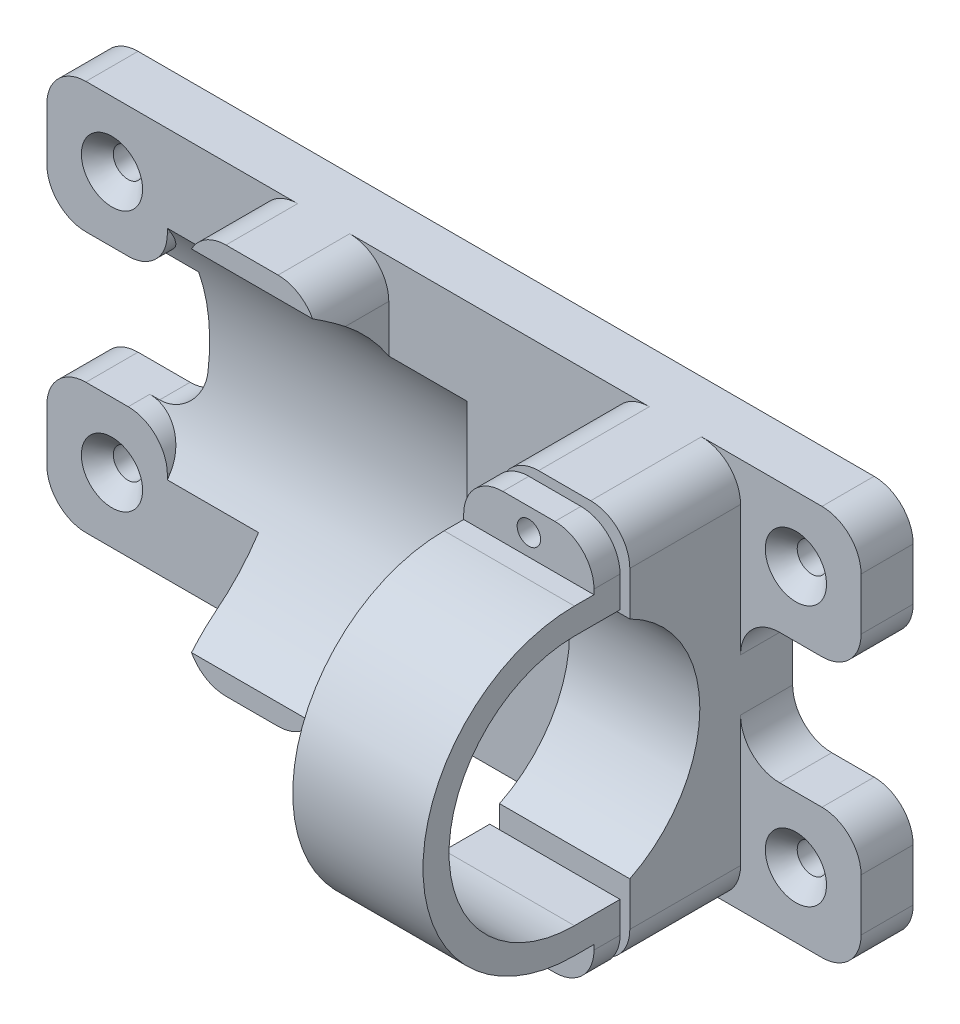
from build123d import *

# Parameters (mm, degrees)
BASE_SKETCH_W               = 85
BASE_SKETCH_H               = 60
BASE_EXTRUDE_DEPTH          = 8
CRADLE_SKETCH_W             = 20
CRADLE_SKETCH_H             = 60
CRADLE_EXTRUDE_DEPTH        = 25
MOUNTING_TAB_SKETCH_W       = 20
MOUNTING_TAB_SKETCH_H       = 20
MOUNTING_TAB_EXTRUDE_DEPTH  = 8
MOUNTING_TAB_FILLET_R       = 6
MOVE_START                  = 19
MOVE_FACE_OUTLINE_W         = 20
MOVE_FACE_OUTLINE_H         = 60
MOVE_FACE_DEPTH             = 6
CLAMP_THREADED_HOLE_D       = 2.5
MOTOR_START                 = 24
MOTOR_CLAMP_EXTRUDE_DEPTH   = 20
SKETCH9_W                   = 1.8
SKETCH9_H                   = 4
BASE_CORNER_FILLETS_R       = 6
BASE_INISDE_CORNER_FILLET_R = 6
CLAMP_CORNER_FILLETS_R      = 6


# Read off the part's stored shape, not the designer's step: Move Face
with BuildPart() as part:
    # Base Sketch → Base Extrude (new body)
    with BuildSketch(Plane.XY):
        Rectangle(BASE_SKETCH_W, BASE_SKETCH_H)
    extrude(amount=BASE_EXTRUDE_DEPTH)

    # Cradle Sketch → Cradle Extrude (add)
    with BuildSketch(Plane.XY):
        with Locations((-20, 0)):
            Rectangle(CRADLE_SKETCH_W, CRADLE_SKETCH_H)
        with Locations((34, 0)):
            Rectangle(CRADLE_SKETCH_W, CRADLE_SKETCH_H)
    extrude(amount=CRADLE_EXTRUDE_DEPTH)


with BuildPart() as body_2:
    # Mounting Tab Sketch → Mounting Tab Extrude (new body)
    with BuildSketch(Plane.XY):
        with Locations((-52.5, -20)):
            Rectangle(MOUNTING_TAB_SKETCH_W, MOUNTING_TAB_SKETCH_H)
    extrude(amount=MOUNTING_TAB_EXTRUDE_DEPTH)

    # Mounting Tab M4 CS Clearance Hole Profile Sketch → Mounting Tab M4 Counter Sink Clearance Hole (revolve, cut)
    with BuildSketch(Plane(origin=(-52.5, -20, 8), x_dir=(0, -1, 0), z_dir=(1, 0, 0))):
        Polygon((0, 0), (0, 8), (2.25, 8), (2.25, 2.45), (4.7, 0), align=None)
    revolve(axis=Axis((-52.5, -20, 14.35), (0, 0, -1)), mode=Mode.SUBTRACT)

    # Mounting Tab Fillet
    mounting_tab_fillet_edges = [body_2.edges().sort_by_distance(p)[0] for p in [
        (-62.5, -30, 4),
        (-62.5, -10, 4),
    ]]
    fillet(mounting_tab_fillet_edges, radius=MOUNTING_TAB_FILLET_R)


with BuildPart() as body_3:
    # Mounting Tab Mirror Lengthwise: mirrored copy
    add(body_2.part.mirror(Plane(origin=(0, 0, 0), x_dir=(0, 0, 1), z_dir=(1, 0, 0))))


with BuildPart() as body_4:
    # Mounting Tab Mirror Width: mirrored copy
    add(body_2.part.mirror(Plane.ZX))


with BuildPart() as body_5:
    # Mounting Tab Mirror Width 2: mirrored copy
    add(body_3.part.mirror(Plane.ZX))


with BuildPart() as part_1:
    add(part.part)

    # Base and Tabs Combine: union body 2, body 3, body 4, body 5
    add(body_2.part)
    add(body_3.part)
    add(body_4.part)
    add(body_5.part)

    # Pump and Motor Revolve Cut Sketch → Pump and Motor Revolve Cut (revolve, cut)
    with BuildSketch(Plane(origin=(0, 0, 0), x_dir=(1, 0, 0), z_dir=(0, 1, 0))):
        Polygon((-44, -33.5), (-44, -3), (2, -3), (2, -14.25), (66, -14.25), (66, -33.5), align=None)
    revolve(axis=Axis((66, 0, 33.5), (-1, 0, 0)), mode=Mode.SUBTRACT)

    # Move Face outline → Move Face (cut)
    with BuildSketch(Plane.XY.offset(MOVE_START)):
        with Locations((-20, 0)):
            Rectangle(MOVE_FACE_OUTLINE_W, MOVE_FACE_OUTLINE_H)
    extrude(amount=MOVE_FACE_DEPTH, mode=Mode.SUBTRACT)

    # Clamp Threaded Hole (through all)
    with Locations(Plane.XY.offset(25)):
        with Locations((34, -26.5)):
            clamp_threaded_hole = Hole(CLAMP_THREADED_HOLE_D / 2)


with BuildPart() as body_2_2:
    # Hold Down Bracket Sketch → Motor Clamp Extrude (new body)
    with BuildSketch(Plane(origin=(0, 0, 0), x_dir=(0, 0, -1), z_dir=(1, 0, 0)).offset(MOTOR_START)):
        with BuildLine():
            Line((-33.5, -23.25), (-30.5, -23.25))
            Line((-30.5, -23.25), (-30.5, -30))
            Line((-30.5, -30), (-26.5, -30))
            Line((-26.5, -30), (-26.5, -19.25))
            Line((-26.5, -19.25), (-33.5, -19.25))
            ThreePointArc((-33.5, -19.25), (-52.75, 0), (-33.5, 19.25))
            Line((-33.5, 19.25), (-26.5, 19.25))
            Line((-26.5, 19.25), (-26.5, 30))
            Line((-26.5, 30), (-30.5, 30))
            Line((-30.5, 30), (-30.5, 23.25))
            Line((-30.5, 23.25), (-33.5, 23.25))
            ThreePointArc((-33.5, 23.25), (-56.75, 0), (-33.5, -23.25))
        make_face()
    extrude(amount=MOTOR_CLAMP_EXTRUDE_DEPTH)

    # Sketch9 → Clamp Clearance Hole (revolve, cut)
    with BuildSketch(Plane(origin=(34, -26.5, 30.5), x_dir=(0, -1, 0), z_dir=(1, 0, 0))):
        with Locations((0.9, 2)):
            Rectangle(SKETCH9_W, SKETCH9_H)
    clamp_clearance_hole = revolve(axis=Axis((34, -26.5, 36.85), (0, 0, -1)), mode=Mode.SUBTRACT)


with BuildPart() as motor_clamp_screw_holes_mirror_tool:
    # Motor Clamp Screw Holes Mirror: Clamp Threaded Hole, Clamp Clearance Hole across plane
    add(clamp_threaded_hole.mirror(Plane.ZX))
    add(clamp_clearance_hole.mirror(Plane.ZX))


with BuildPart() as part_2:
    add(part_1.part)

    # Motor Clamp Screw Holes Mirror: cut by motor_clamp_screw_holes_mirror_tool
    add(motor_clamp_screw_holes_mirror_tool.part, mode=Mode.SUBTRACT)

    # Base Corner Fillets
    base_corner_fillets_edges = [part_2.edges().sort_by_distance(p)[0] for p in [
        (44, -10, 4),
        (-10, -30, 13.5),
        (-30, -30, 13.5),
        (-30, 30, 13.5),
        (-10, 30, 13.5),
        (44, -30, 16.5),
        (24, -30, 16.5),
        (24, 30, 16.5),
        (44, 30, 16.5),
        (-44, -10, 6.342970466),
        (44, 10, 4),
        (-44, 10, 6.342970466),
    ]]
    fillet(base_corner_fillets_edges, radius=BASE_CORNER_FILLETS_R)

    # Base Inisde Corner Fillet
    base_inisde_corner_fillet_edges = [part_2.edges().sort_by_distance(p)[0] for p in [
        (-42.5, -10, 2.342970466),
    ]]
    fillet(base_inisde_corner_fillet_edges, radius=BASE_INISDE_CORNER_FILLET_R)


with BuildPart() as body_2_2_1:
    add(body_2_2.part)

    # Motor Clamp Screw Holes Mirror: cut by motor_clamp_screw_holes_mirror_tool
    add(motor_clamp_screw_holes_mirror_tool.part, mode=Mode.SUBTRACT)

    # Clamp Corner Fillets
    clamp_corner_fillets_edges = [body_2_2_1.edges().sort_by_distance(p)[0] for p in [
        (24, -30, 28.5),
        (24, 30, 28.5),
        (44, 30, 28.5),
        (44, -30, 28.5),
    ]]
    fillet(clamp_corner_fillets_edges, radius=CLAMP_CORNER_FILLETS_R)


solid = Compound([part_2.part, body_2_2_1.part])
